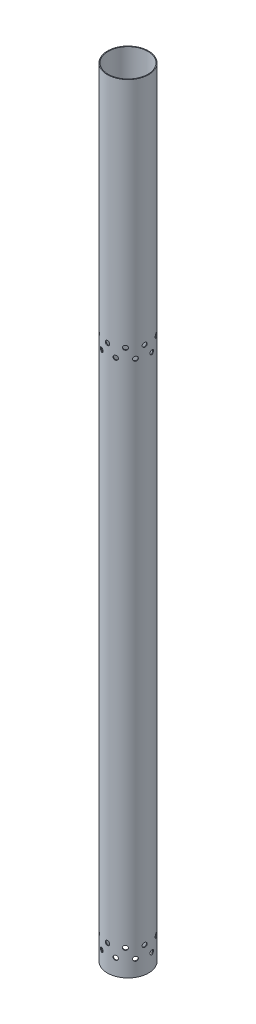
from build123d import *

# Parameters (mm, degrees)
SKETCH1_R                  = 52.74818
SKETCH1_R_2                = 50.8381
BOSS_EXTRUDE1_DEPTH        = 1993.9
SKETCH4_R                  = 5.55625
CUT_EXTRUDE2_DEPTH         = 1996.294953381
CIRPATTERN1_COUNT          = 9
SKETCH7_R                  = 5.55625
CUT_EXTRUDE4_DEPTH         = 1996.294953486
CIRPATTERN2_COUNT          = 9
LPATTERN1_COPY_1_SKETCH_R  = 5.55625
LPATTERN1_COPY_1_DEPTH     = 1996.294953381
LPATTERN1_COPY_2_SKETCH_R  = 5.55625
LPATTERN1_COPY_2_DEPTH     = 1996.294953381
LPATTERN1_COPY_3_SKETCH_R  = 5.55625
LPATTERN1_COPY_3_DEPTH     = 1996.294953381
LPATTERN1_COPY_4_SKETCH_R  = 5.55625
LPATTERN1_COPY_4_DEPTH     = 1996.294953381
LPATTERN1_COPY_5_SKETCH_R  = 5.55625
LPATTERN1_COPY_5_DEPTH     = 1996.294953381
LPATTERN1_COPY_6_SKETCH_R  = 5.55625
LPATTERN1_COPY_6_DEPTH     = 1996.294953381
LPATTERN1_COPY_7_SKETCH_R  = 5.55625
LPATTERN1_COPY_7_DEPTH     = 1996.294953381
LPATTERN1_COPY_8_SKETCH_R  = 5.55625
LPATTERN1_COPY_8_DEPTH     = 1996.294953381
LPATTERN1_COPY_9_SKETCH_R  = 5.55625
LPATTERN1_COPY_9_DEPTH     = 1996.294953381
LPATTERN1_COPY_10_SKETCH_R = 5.55625
LPATTERN1_COPY_10_DEPTH    = 1996.294953486
LPATTERN1_COPY_11_SKETCH_R = 5.55625
LPATTERN1_COPY_11_DEPTH    = 1996.294953486
LPATTERN1_COPY_12_SKETCH_R = 5.55625
LPATTERN1_COPY_12_DEPTH    = 1996.294953486
LPATTERN1_COPY_13_SKETCH_R = 5.55625
LPATTERN1_COPY_13_DEPTH    = 1996.294953486
LPATTERN1_COPY_14_SKETCH_R = 5.55625
LPATTERN1_COPY_14_DEPTH    = 1996.294953486
LPATTERN1_COPY_15_SKETCH_R = 5.55625
LPATTERN1_COPY_15_DEPTH    = 1996.294953486
LPATTERN1_COPY_16_SKETCH_R = 5.55625
LPATTERN1_COPY_16_DEPTH    = 1996.294953486
LPATTERN1_COPY_17_SKETCH_R = 5.55625
LPATTERN1_COPY_17_DEPTH    = 1996.294953486
LPATTERN1_COPY_18_SKETCH_R = 5.55625
LPATTERN1_COPY_18_DEPTH    = 1996.294953486


with BuildPart() as part:
    # Sketch1 → Boss-Extrude1 (new body)
    with BuildSketch(Plane(origin=(0, 0, 0), x_dir=(1, 0, 0), z_dir=(0, 1, 0))):
        Circle(SKETCH1_R)
        Circle(SKETCH1_R_2, mode=Mode.SUBTRACT)
    extrude(amount=BOSS_EXTRUDE1_DEPTH)

    # Sketch4 → Cut-Extrude2 (cut, through all)
    with BuildSketch(Plane.XY):
        with Locations((0, 41.3766)):
            Circle(SKETCH4_R)
    cut_extrude2 = extrude(amount=-CUT_EXTRUDE2_DEPTH, mode=Mode.SUBTRACT)

    # CirPattern1: Cut-Extrude2 ×9 about axis
    cirpattern1_axis = Axis((0, 1993.9, 0), (0, -1, 0))
    for i in range(1, CIRPATTERN1_COUNT):
        add(cut_extrude2.rotate(cirpattern1_axis, i * 360 / CIRPATTERN1_COUNT), mode=Mode.SUBTRACT)

    # Sketch7 → Cut-Extrude4 (cut, through all)
    with BuildSketch(Plane(origin=(0, 0, 0), x_dir=(0, -1, 0), z_dir=(-0.34202014332566943, 0, 0.9396926207859081))):
        with Locations((-66.7766, 0)):
            Circle(SKETCH7_R)
    cut_extrude4 = extrude(amount=-CUT_EXTRUDE4_DEPTH, mode=Mode.SUBTRACT)

    # CirPattern2: Cut-Extrude4 ×9 about axis
    cirpattern2_axis = Axis((0, 1993.9, 0), (0, -1, 0))
    for i in range(1, CIRPATTERN2_COUNT):
        add(cut_extrude4.rotate(cirpattern2_axis, i * 360 / CIRPATTERN2_COUNT), mode=Mode.SUBTRACT)

    # LPattern1 copy 1 sketch → LPattern1 copy 1 (cut, through all)
    with BuildSketch(Plane(origin=(0, 1331.6966, 0), x_dir=(0.766044443118978, 0, 0.6427876096865393), z_dir=(-0.6427876096865393, 0, 0.766044443118978))):
        with Locations((0, 41.3766)):
            Circle(LPATTERN1_COPY_1_SKETCH_R)
    extrude(amount=-LPATTERN1_COPY_1_DEPTH, mode=Mode.SUBTRACT)

    # LPattern1 copy 2 sketch → LPattern1 copy 2 (cut, through all)
    with BuildSketch(Plane(origin=(0, 1331.6966, 0), x_dir=(0.17364817766693041, 0, 0.984807753012208), z_dir=(-0.984807753012208, 0, 0.17364817766693041))):
        with Locations((0, 41.3766)):
            Circle(LPATTERN1_COPY_2_SKETCH_R)
    extrude(amount=-LPATTERN1_COPY_2_DEPTH, mode=Mode.SUBTRACT)

    # LPattern1 copy 3 sketch → LPattern1 copy 3 (cut, through all)
    with BuildSketch(Plane(origin=(0, 1331.6966, 0), x_dir=(-0.4999999999999998, 0, 0.8660254037844387), z_dir=(-0.8660254037844387, 0, -0.4999999999999998))):
        with Locations((0, 41.3766)):
            Circle(LPATTERN1_COPY_3_SKETCH_R)
    extrude(amount=-LPATTERN1_COPY_3_DEPTH, mode=Mode.SUBTRACT)

    # LPattern1 copy 4 sketch → LPattern1 copy 4 (cut, through all)
    with BuildSketch(Plane(origin=(0, 1331.6966, 0), x_dir=(-0.9396926207859083, 0, 0.3420201433256689), z_dir=(-0.3420201433256689, 0, -0.9396926207859083))):
        with Locations((0, 41.3766)):
            Circle(LPATTERN1_COPY_4_SKETCH_R)
    extrude(amount=-LPATTERN1_COPY_4_DEPTH, mode=Mode.SUBTRACT)

    # LPattern1 copy 5 sketch → LPattern1 copy 5 (cut, through all)
    with BuildSketch(Plane(origin=(0, 1331.6966, 0), x_dir=(-0.9396926207859084, 0, -0.34202014332566866), z_dir=(0.34202014332566866, 0, -0.9396926207859084))):
        with Locations((0, 41.3766)):
            Circle(LPATTERN1_COPY_5_SKETCH_R)
    extrude(amount=-LPATTERN1_COPY_5_DEPTH, mode=Mode.SUBTRACT)

    # LPattern1 copy 6 sketch → LPattern1 copy 6 (cut, through all)
    with BuildSketch(Plane(origin=(0, 1331.6966, 0), x_dir=(-0.5000000000000004, 0, -0.8660254037844384), z_dir=(0.8660254037844384, 0, -0.5000000000000004))):
        with Locations((0, 41.3766)):
            Circle(LPATTERN1_COPY_6_SKETCH_R)
    extrude(amount=-LPATTERN1_COPY_6_DEPTH, mode=Mode.SUBTRACT)

    # LPattern1 copy 7 sketch → LPattern1 copy 7 (cut, through all)
    with BuildSketch(Plane(origin=(0, 1331.6966, 0), x_dir=(0.17364817766692997, 0, -0.9848077530122081), z_dir=(0.9848077530122081, 0, 0.17364817766692997))):
        with Locations((0, 41.3766)):
            Circle(LPATTERN1_COPY_7_SKETCH_R)
    extrude(amount=-LPATTERN1_COPY_7_DEPTH, mode=Mode.SUBTRACT)

    # LPattern1 copy 8 sketch → LPattern1 copy 8 (cut, through all)
    with BuildSketch(Plane(origin=(0, 1331.6966, 0), x_dir=(0.7660444431189778, 0, -0.6427876096865396), z_dir=(0.6427876096865396, 0, 0.7660444431189778))):
        with Locations((0, 41.3766)):
            Circle(LPATTERN1_COPY_8_SKETCH_R)
    extrude(amount=-LPATTERN1_COPY_8_DEPTH, mode=Mode.SUBTRACT)

    # LPattern1 copy 9 sketch → LPattern1 copy 9 (cut, through all)
    with BuildSketch(Plane(origin=(0, 1331.6966, 0), x_dir=(1, 0, 0), z_dir=(0, 0, 1))):
        with Locations((0, 41.3766)):
            Circle(LPATTERN1_COPY_9_SKETCH_R)
    extrude(amount=-LPATTERN1_COPY_9_DEPTH, mode=Mode.SUBTRACT)

    # LPattern1 copy 10 sketch → LPattern1 copy 10 (cut, through all)
    with BuildSketch(Plane(origin=(0, 1331.6966, 0), x_dir=(0, -1, 0), z_dir=(-0.8660254037844388, 0, 0.49999999999999933))):
        with Locations((-66.7766, 0)):
            Circle(LPATTERN1_COPY_10_SKETCH_R)
    extrude(amount=-LPATTERN1_COPY_10_DEPTH, mode=Mode.SUBTRACT)

    # LPattern1 copy 11 sketch → LPattern1 copy 11 (cut, through all)
    with BuildSketch(Plane(origin=(0, 1331.6966, 0), x_dir=(0, -1, 0), z_dir=(-0.9848077530122079, 0, -0.17364817766693103))):
        with Locations((-66.7766, 0)):
            Circle(LPATTERN1_COPY_11_SKETCH_R)
    extrude(amount=-LPATTERN1_COPY_11_DEPTH, mode=Mode.SUBTRACT)

    # LPattern1 copy 12 sketch → LPattern1 copy 12 (cut, through all)
    with BuildSketch(Plane(origin=(0, 1331.6966, 0), x_dir=(0, -1, 0), z_dir=(-0.6427876096865388, 0, -0.7660444431189783))):
        with Locations((-66.7766, 0)):
            Circle(LPATTERN1_COPY_12_SKETCH_R)
    extrude(amount=-LPATTERN1_COPY_12_DEPTH, mode=Mode.SUBTRACT)

    # LPattern1 copy 13 sketch → LPattern1 copy 13 (cut, through all)
    with BuildSketch(Plane(origin=(0, 1331.6966, 0), x_dir=(0, -1, 0), z_dir=(0, 0, -1))):
        with Locations((-66.7766, 0)):
            Circle(LPATTERN1_COPY_13_SKETCH_R)
    extrude(amount=-LPATTERN1_COPY_13_DEPTH, mode=Mode.SUBTRACT)

    # LPattern1 copy 14 sketch → LPattern1 copy 14 (cut, through all)
    with BuildSketch(Plane(origin=(0, 1331.6966, 0), x_dir=(0, -1, 0), z_dir=(0.6427876096865399, 0, -0.7660444431189777))):
        with Locations((-66.7766, 0)):
            Circle(LPATTERN1_COPY_14_SKETCH_R)
    extrude(amount=-LPATTERN1_COPY_14_DEPTH, mode=Mode.SUBTRACT)

    # LPattern1 copy 15 sketch → LPattern1 copy 15 (cut, through all)
    with BuildSketch(Plane(origin=(0, 1331.6966, 0), x_dir=(0, -1, 0), z_dir=(0.984807753012208, 0, -0.17364817766693014))):
        with Locations((-66.7766, 0)):
            Circle(LPATTERN1_COPY_15_SKETCH_R)
    extrude(amount=-LPATTERN1_COPY_15_DEPTH, mode=Mode.SUBTRACT)

    # LPattern1 copy 16 sketch → LPattern1 copy 16 (cut, through all)
    with BuildSketch(Plane(origin=(0, 1331.6966, 0), x_dir=(0, -1, 0), z_dir=(0.8660254037844385, 0, 0.5000000000000003))):
        with Locations((-66.7766, 0)):
            Circle(LPATTERN1_COPY_16_SKETCH_R)
    extrude(amount=-LPATTERN1_COPY_16_DEPTH, mode=Mode.SUBTRACT)

    # LPattern1 copy 17 sketch → LPattern1 copy 17 (cut, through all)
    with BuildSketch(Plane(origin=(0, 1331.6966, 0), x_dir=(0, -1, 0), z_dir=(0.3420201433256683, 0, 0.9396926207859085))):
        with Locations((-66.7766, 0)):
            Circle(LPATTERN1_COPY_17_SKETCH_R)
    extrude(amount=-LPATTERN1_COPY_17_DEPTH, mode=Mode.SUBTRACT)

    # LPattern1 copy 18 sketch → LPattern1 copy 18 (cut, through all)
    with BuildSketch(Plane(origin=(0, 1331.6966, 0), x_dir=(0, -1, 0), z_dir=(-0.34202014332566943, 0, 0.9396926207859081))):
        with Locations((-66.7766, 0)):
            Circle(LPATTERN1_COPY_18_SKETCH_R)
    extrude(amount=-LPATTERN1_COPY_18_DEPTH, mode=Mode.SUBTRACT)


solid = part.part
